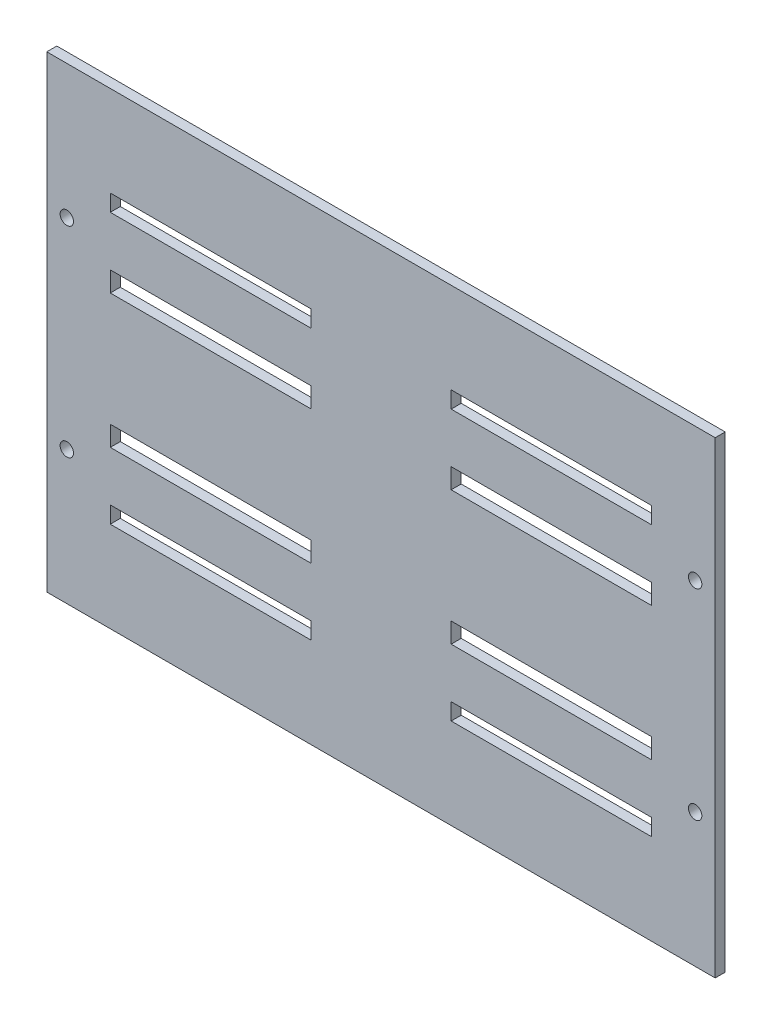
from build123d import *

# Parameters (mm, degrees)
SKETCH_2_W               = 200
SKETCH_2_H               = 140
EXTRUDE_1_DEPTH          = 3
SKETCH_3_R               = 2
CUT_EXTRUDE_1_DEPTH      = 3
SKETCH_4_W               = 60
SKETCH_4_H               = 6
CUT_EXTRUDE_2_DEPTH      = 10
SKETCH_5_W               = 60
SKETCH_5_H               = 5
CUT_EXTRUDE_3_DEPTH      = 6
MIRROR_2_COPY_1_SKETCH_W = 60
MIRROR_2_COPY_1_SKETCH_H = 5
MIRROR_2_COPY_1_DEPTH    = 6


with BuildPart() as part:
    # 草图2 → 凸台-拉伸1 (new body)
    with BuildSketch(Plane.XY):
        Rectangle(SKETCH_2_W, SKETCH_2_H)
    extrude(amount=EXTRUDE_1_DEPTH)

    # 草图3 → 切除-拉伸1 (cut)
    with BuildSketch(Plane.XY.offset(3)):
        with Locations((94, 30)):
            Circle(SKETCH_3_R)
        with Locations((94, -30)):
            Circle(SKETCH_3_R)
    cut_extrude_1 = extrude(amount=-CUT_EXTRUDE_1_DEPTH, mode=Mode.SUBTRACT)

    # 草图4 → 切除-拉伸2 (cut)
    with BuildSketch(Plane.XY.offset(3)):
        with Locations((51, 20)):
            Rectangle(SKETCH_4_W, SKETCH_4_H)
        with Locations((51, -20)):
            Rectangle(SKETCH_4_W, SKETCH_4_H)
    cut_extrude_2 = extrude(amount=-CUT_EXTRUDE_2_DEPTH, mode=Mode.SUBTRACT)

    # 草图5 → 切除-拉伸3 (cut)
    with BuildSketch(Plane(origin=(0, 0, 0), x_dir=(-1, 0, 0), z_dir=(0, 0, -1))):
        with Locations((-51, 40.40876744)):
            Rectangle(SKETCH_5_W, SKETCH_5_H)
    cut_extrude_3 = extrude(amount=-CUT_EXTRUDE_3_DEPTH, mode=Mode.SUBTRACT)

    # 镜向1: 切除-拉伸3 across plane
    add(cut_extrude_3.mirror(Plane.ZX), mode=Mode.SUBTRACT)

    # 镜向2: 切除-拉伸1, 切除-拉伸2, 切除-拉伸3 across plane
    add(cut_extrude_1.mirror(Plane.ZY), mode=Mode.SUBTRACT)
    add(cut_extrude_2.mirror(Plane.ZY), mode=Mode.SUBTRACT)
    add(cut_extrude_3.mirror(Plane.ZY), mode=Mode.SUBTRACT)

    # 镜向2 copy 1 sketch → 镜向2 copy 1 (cut)
    with BuildSketch(Plane(origin=(0, 0, 0), x_dir=(1, 0, 0), z_dir=(0, 0, -1))):
        with Locations((-51, 40.40876744)):
            Rectangle(MIRROR_2_COPY_1_SKETCH_W, MIRROR_2_COPY_1_SKETCH_H)
    extrude(amount=-MIRROR_2_COPY_1_DEPTH, mode=Mode.SUBTRACT)


solid = part.part
